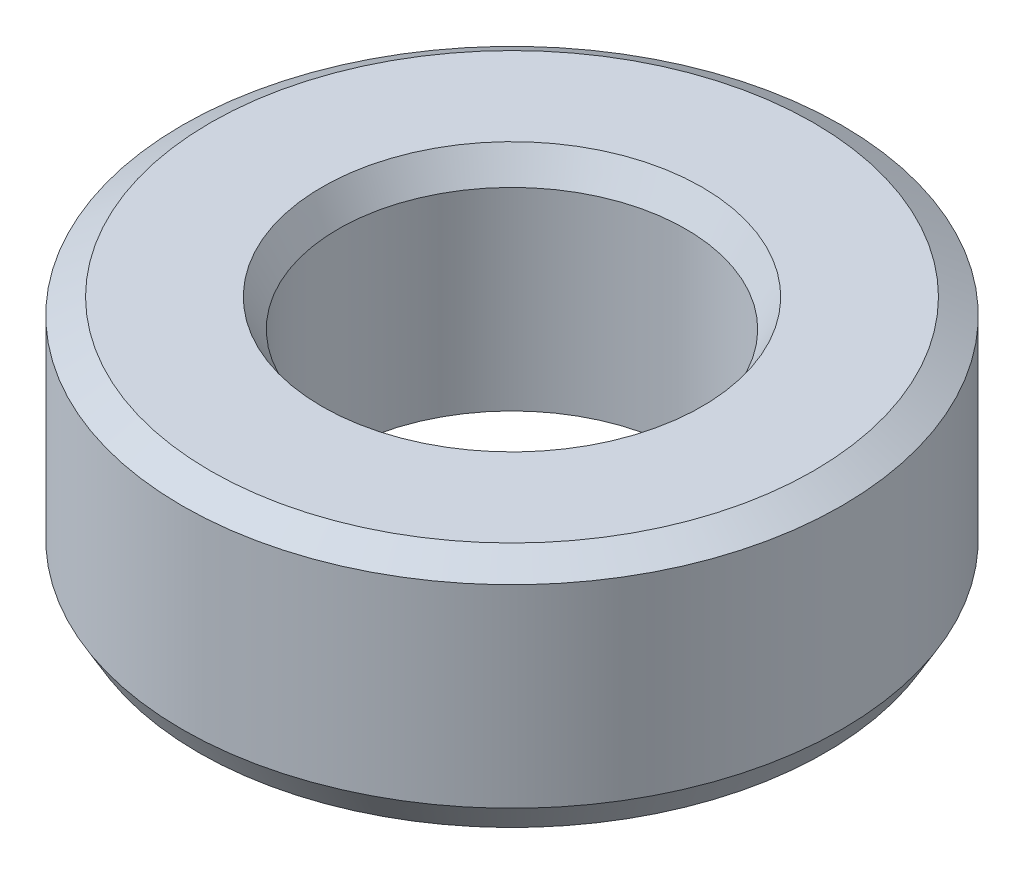
from build123d import *
from OCP.BRepFilletAPI import BRepFilletAPI_MakeChamfer

# Parameters (mm, degrees)
SKETCH1_R           = 47.5
BOSS_EXTRUDE1_DEPTH = 34.286370078
SKETCH2_R           = 25.035192213
CUT_EXTRUDE1_DEPTH  = 76.419196317
CHAMFER1_SIZE       = 2.340276478
CHAMFER1_SIZE2      = 4.053477764


with BuildPart() as part:
    # Sketch1 → Boss-Extrude1 (new body)
    with BuildSketch(Plane(origin=(0, 0, 0), x_dir=(1, 0, 0), z_dir=(0, 1, 0))):
        Circle(SKETCH1_R)
    extrude(amount=BOSS_EXTRUDE1_DEPTH)

    # Sketch2 → Cut-Extrude1 (cut, through all)
    with BuildSketch(Plane(origin=(0, 0, 0), x_dir=(1, 0, 0), z_dir=(0, 1, 0))):
        Circle(SKETCH2_R)
    extrude(amount=CUT_EXTRUDE1_DEPTH, mode=Mode.SUBTRACT)

    # Chamfer1: one chamfer whose edges measure the first distance from different faces: ONE call of the kernel's chamfer builder (chamfer() names one face for all edges)
    chamfer1_edges_1 = [part.edges().sort_by_distance(p)[0] for p in [
        (-25.035192213, 34.286370078, 0),
    ]]
    chamfer1_side_1 = [part.faces().sort_by_distance(p)[0] for p in [
        (-46.156497116, 34.286370078, 0),
    ]]
    chamfer1_edges_2 = [part.edges().sort_by_distance(p)[0] for p in [
        (-25.035192213, 0, 0),
    ]]
    chamfer1_side_2 = [part.faces().sort_by_distance(p)[0] for p in [
        (-25.035192213, 17.143185039, 0),
    ]]
    chamfer1_edges_3 = [part.edges().sort_by_distance(p)[0] for p in [
        (-47.5, 0, 0),
    ]]
    chamfer1_side_3 = [part.faces().sort_by_distance(p)[0] for p in [
        (-46.156497116, 0, 0),
    ]]
    chamfer1_edges_4 = [part.edges().sort_by_distance(p)[0] for p in [
        (-47.5, 34.286370078, 0),
    ]]
    chamfer1_side_4 = [part.faces().sort_by_distance(p)[0] for p in [
        (-47.5, 17.143185039, 0),
    ]]
    chamfer1 = BRepFilletAPI_MakeChamfer(part.part.solid().wrapped)
    for e in chamfer1_edges_1:
        chamfer1.Add(CHAMFER1_SIZE, CHAMFER1_SIZE2, e.wrapped, chamfer1_side_1[0].wrapped)  # the first distance lies on this face
    for e in chamfer1_edges_2:
        chamfer1.Add(CHAMFER1_SIZE, CHAMFER1_SIZE2, e.wrapped, chamfer1_side_2[0].wrapped)  # the first distance lies on this face
    for e in chamfer1_edges_3:
        chamfer1.Add(CHAMFER1_SIZE, CHAMFER1_SIZE2, e.wrapped, chamfer1_side_3[0].wrapped)  # the first distance lies on this face
    for e in chamfer1_edges_4:
        chamfer1.Add(CHAMFER1_SIZE, CHAMFER1_SIZE2, e.wrapped, chamfer1_side_4[0].wrapped)  # the first distance lies on this face
    add(Compound.cast(chamfer1.Shape()), mode=Mode.REPLACE)


solid = part.part
